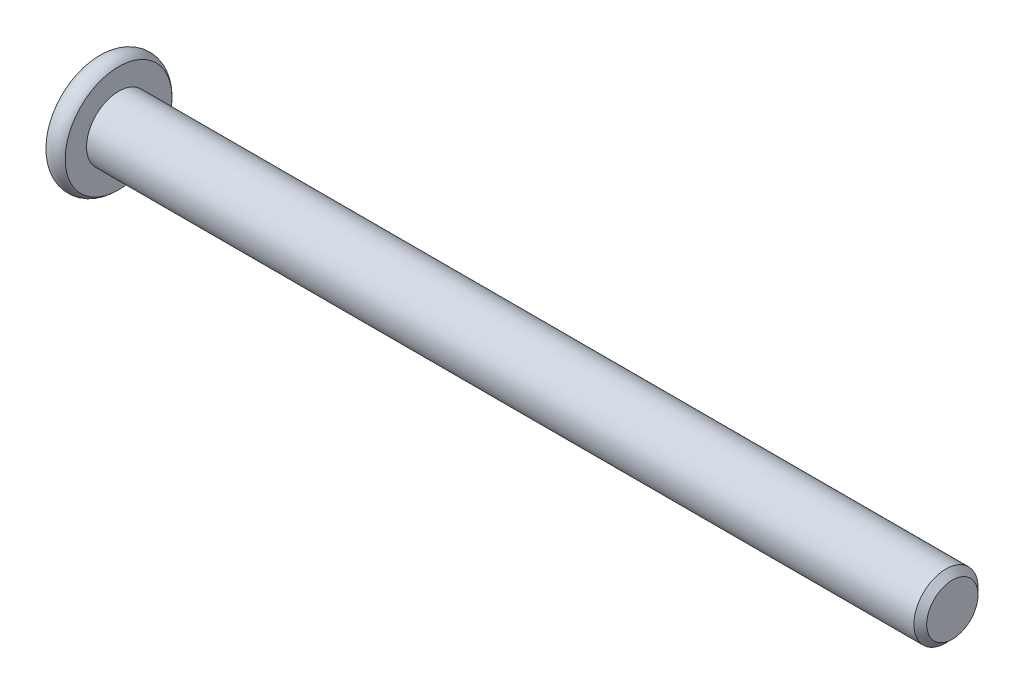
from build123d import *

# Parameters (mm, degrees)
SKETCH2_R           = 2.5
BOSS_EXTRUDE1_DEPTH = 65
CHAMFER1_SIZE       = 0.5
CUT_EXTRUDE1_DEPTH  = 2.3
SKETCH8_R           = 1.782050808
CUT_EXTRUDE2_DEPTH  = 1
CUT_EXTRUDE2_DRAFT  = -45


with BuildPart() as part:
    # Sketch2 → Boss-Extrude1 (new body)
    with BuildSketch(Plane(origin=(0, 0, 0), x_dir=(0, 0, -1), z_dir=(1, 0, 0))):
        Circle(SKETCH2_R)
    extrude(amount=-BOSS_EXTRUDE1_DEPTH)

    # Chamfer1
    chamfer1_edges = [part.edges().sort_by_distance(p)[0] for p in [
        (0, 0, 2.5),
    ]]
    chamfer(chamfer1_edges, length=CHAMFER1_SIZE)

    # Sketch6 → Revolve1 (revolve)
    with BuildSketch(Plane.XY):
        with BuildLine():
            Line((-66.5, 0), (-66.5, 4.161437828))
            ThreePointArc((-66.5, 4.161437828), (-65.75, 4.5), (-65, 4.161437828))
            Line((-65, 4.161437828), (-65, 0))
            Line((-65, 0), (-66.5, 0))
        make_face()
    revolve(axis=Axis((-65, 0, 0), (1, 0, 0)))

    # Sketch7 → Cut-Extrude1 (cut)
    with BuildSketch(Plane.ZY.offset(66.5)):
        Polygon((0, 1.732050808), (-1.5, 0.866025404), (-1.5, -0.866025404), (0, -1.732050808), (1.5, -0.866025404), (1.5, 0.866025404), align=None)
    extrude(amount=-CUT_EXTRUDE1_DEPTH, mode=Mode.SUBTRACT)


with BuildPart() as cut_extrude2_tool:
    # Sketch8 → Cut-Extrude2 (with draft: the straight prism first)
    with BuildSketch(Plane.ZY.offset(66.5)):
        Circle(SKETCH8_R)
    extrude(amount=-CUT_EXTRUDE2_DEPTH)
    # Cut-Extrude2: the draft: its side faces are tilted about the plane it starts from
    cut_extrude2_sides = [cut_extrude2_tool.faces().sort_by_distance(p)[0] for p in [
        (-66, 0, -1.782050808),
    ]]
    draft(cut_extrude2_sides, Plane.ZY.offset(66.5), CUT_EXTRUDE2_DRAFT)


with BuildPart() as part_1:
    add(part.part)

    # Cut-Extrude2: cut by cut_extrude2_tool
    add(cut_extrude2_tool.part, mode=Mode.SUBTRACT)


solid = part_1.part
